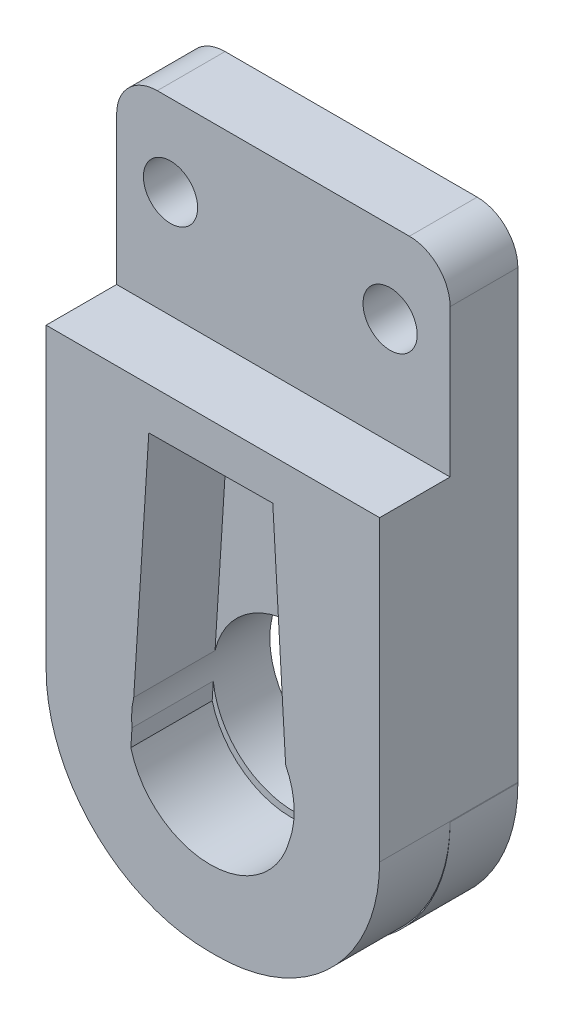
from build123d import *

# Parameters (mm, degrees)
BOSS_EXTRUDE1_DEPTH = 2.5
FILLET1_R           = 6
FILLET2_R           = 1.5
SKETCH3_R           = 0.9999999999999983
CUT_EXTRUDE1_DEPTH  = 3.5
BOSS_EXTRUDE2_DEPTH = 2.6
SKETCH5_R           = 2.9999999999999947
CUT_EXTRUDE2_DEPTH  = 406.0937861882827
CUT_EXTRUDE3_DEPTH  = 3
FILLET3_R           = 6


with BuildPart() as part:
    # Sketch2 → Boss-Extrude1 (new body)
    with BuildSketch(Plane.XY.offset(10)):
        Polygon((-326.0372348081085, 240.3636560028167), (-313.73723480810855, 240.3636560028167), (-313.7372348081085, 216.3636560028167), (-326.0372348081085, 216.3636560028167), align=None)
    extrude(amount=BOSS_EXTRUDE1_DEPTH)

    # Fillet1
    fillet1_edges = [part.edges().sort_by_distance(p)[0] for p in [
        (-313.7372348081085, 216.3636560028167, 11.25),
        (-326.0372348081085, 216.3636560028167, 11.25),
    ]]
    fillet(fillet1_edges, radius=FILLET1_R)

    # Fillet2
    fillet2_edges = [part.edges().sort_by_distance(p)[0] for p in [
        (-326.0372348081085, 240.3636560028167, 11.25),
        (-313.73723480810855, 240.3636560028167, 11.25),
    ]]
    fillet(fillet2_edges, radius=FILLET2_R)

    # Sketch3 → Cut-Extrude1 (cut)
    with BuildSketch(Plane.XY.offset(12.5)):
        with Locations((-324.0490905957561, 237.3636560028167)):
            Circle(SKETCH3_R)
        with Locations((-315.94909059575616, 237.3636560028167)):
            Circle(SKETCH3_R)
    extrude(amount=-CUT_EXTRUDE1_DEPTH, mode=Mode.SUBTRACT)

    # Sketch4 → Boss-Extrude2 (add)
    with BuildSketch(Plane.XY.offset(12.5)):
        Polygon((-326.0372348081085, 233.42269782366114), (-313.7372348081087, 233.42269782366114), (-313.7372348081086, 216.42269782366117), (-326.0372348081085, 216.42269782366117), align=None)
    extrude(amount=BOSS_EXTRUDE2_DEPTH)

    # Sketch5 → Cut-Extrude2 (cut, through all)
    with BuildSketch(Plane.XY.offset(15.100000000000001)):
        with Locations((-319.88723480810853, 222.45389289856294)):
            Circle(SKETCH5_R)
    extrude(amount=-CUT_EXTRUDE2_DEPTH, mode=Mode.SUBTRACT)

    # Sketch6 → Cut-Extrude3 (cut)
    with BuildSketch(Plane.XY.offset(15.100000000000001)):
        with BuildLine():
            Line((-322.2509023799276, 231.87527778635172), (-317.6775841933858, 231.916179418332))
            Line((-317.6775841933858, 231.916179418332), (-317.06574253676285, 221.43449044480062))
            ThreePointArc((-317.06574253676285, 221.43449044480062), (-320.0096946123076, 219.21611603523496), (-322.9124096628873, 221.4881820948509))
            Line((-322.9124096628873, 221.4881820948509), (-322.2509023799276, 231.87527778635172))
        make_face()
    extrude(amount=-CUT_EXTRUDE3_DEPTH, mode=Mode.SUBTRACT)

    # Fillet3
    # the kernel refuses this fillet: 6 mm, written as the material it takes off along each edge
    with BuildSketch(Plane(origin=(-326.0372348081085, 216.42269782366117, -2.5000000000000018), x_dir=(1, 0, 0), z_dir=(0, 0, 1))) as fillet3_piece_1_section:
        with BuildLine():
            CenterArc((FILLET3_R, FILLET3_R), FILLET3_R, 180, 90)
            Line((0, FILLET3_R), (0, 0))
            Line((0, 0), (FILLET3_R, 0))
        make_face()
    fillet3_piece_1 = extrude(amount=32.6, mode=Mode.PRIVATE)
    fillet3_piece_1 = fillet3_piece_1 - Plane(origin=(-320.0372348081085, 222.3636560028167, 11.24999999999967), x_dir=(0, -1, 0), z_dir=(0, 0, 1)) * Cylinder(6, 90, mode=Mode.PRIVATE)
    add(fillet3_piece_1, mode=Mode.SUBTRACT)
    with BuildSketch(Plane(origin=(-326.0372348081085, 216.42269782366117, 12.5), x_dir=(1, 0, 0), z_dir=(0, 0, 1))) as fillet3_piece_2:
        with BuildLine():
            CenterArc((FILLET3_R, FILLET3_R), FILLET3_R, 180, 90)
            Line((0, FILLET3_R), (0, 0))
            Line((0, 0), (FILLET3_R, 0))
        make_face()
    extrude(amount=17.6, mode=Mode.SUBTRACT)
    with BuildSketch(Plane(origin=(-313.7372348081085, 216.42269782366117, -2.5000000000000018), x_dir=(0, 1, 0), z_dir=(0, 0, 1))) as fillet3_piece_3_section:
        with BuildLine():
            CenterArc((FILLET3_R, FILLET3_R), FILLET3_R, 180, 90)
            Line((0, FILLET3_R), (0, 0))
            Line((0, 0), (FILLET3_R, 0))
        make_face()
    fillet3_piece_3 = extrude(amount=32.6, mode=Mode.PRIVATE)
    fillet3_piece_3 = fillet3_piece_3 - Plane(origin=(-319.7372348081085, 222.3636560028167, 11.250000000000943), x_dir=(1, 2.37e-15, 0), z_dir=(0, 0, 1)) * Cylinder(6, 90, mode=Mode.PRIVATE)
    add(fillet3_piece_3, mode=Mode.SUBTRACT)
    with BuildSketch(Plane(origin=(-313.7372348081086, 216.42269782366117, 12.5), x_dir=(1.895e-14, 1, 0), z_dir=(0, 0, 1))) as fillet3_piece_4:
        with BuildLine():
            CenterArc((FILLET3_R, FILLET3_R), FILLET3_R, 180, 90.00000000000108)
            Line((-1.1369e-13, FILLET3_R), (0, 0))
            Line((0, 0), (FILLET3_R, 0))
        make_face()
    extrude(amount=17.6, mode=Mode.SUBTRACT)


solid = part.part
